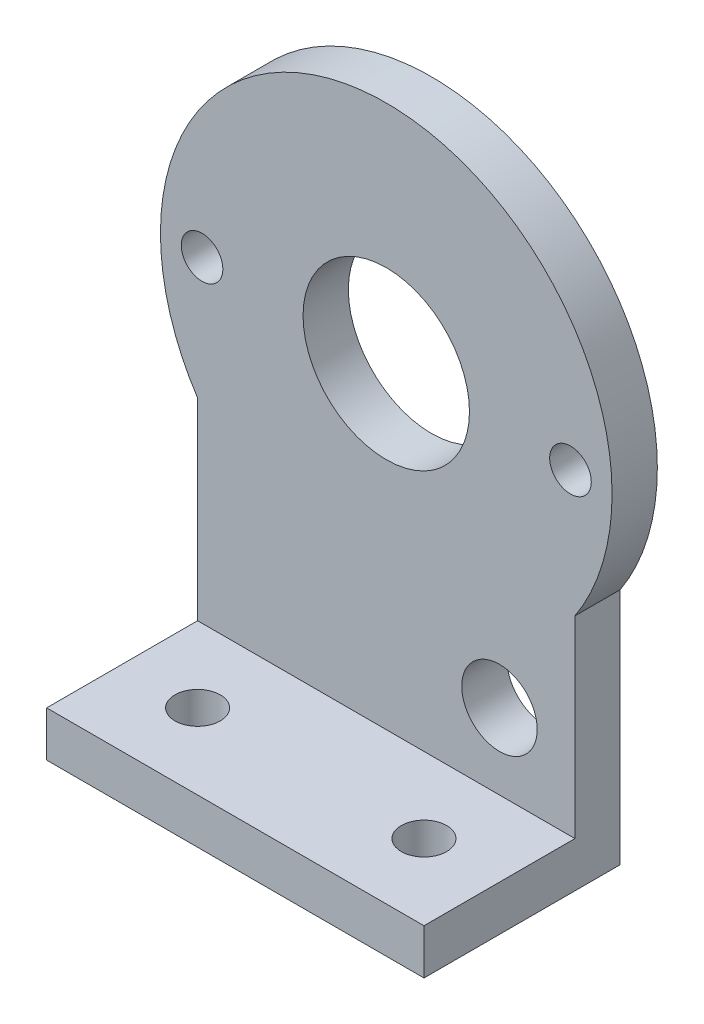
from build123d import *

# Parameters (mm, degrees)
SKETCH1_R           = 19
SKETCH1_W           = 31.75
SKETCH1_H           = 20.04044182
BOSS_EXTRUDE1_DEPTH = 3.81
SKETCH3_R           = 7
CUT_EXTRUDE1_DEPTH  = 37.118506337
SKETCH4_W           = 31.75
SKETCH4_H           = 3.81
BOSS_EXTRUDE2_DEPTH = 12.7
SKETCH5_R           = 1.905
CUT_EXTRUDE2_DEPTH  = 53.147185926
SKETCH6_R           = 1.75
CUT_EXTRUDE3_DEPTH  = 39.096199285
SKETCH7_R           = 3.175
CUT_EXTRUDE4_DEPTH  = 39.096199285


with BuildPart() as part:
    # Sketch1 → Boss-Extrude1 (new body)
    with BuildSketch(Plane.XY):
        Circle(SKETCH1_R)
        with Locations((0, -20.45977909)):
            Rectangle(SKETCH1_W, SKETCH1_H)
    extrude(amount=BOSS_EXTRUDE1_DEPTH)

    # Sketch3 → Cut-Extrude1 (cut, through all)
    with BuildSketch(Plane.XY.offset(3.81)):
        Circle(SKETCH3_R)
    extrude(amount=-CUT_EXTRUDE1_DEPTH, mode=Mode.SUBTRACT)

    # Sketch4 → Boss-Extrude2 (add)
    with BuildSketch(Plane.XY.offset(3.81)):
        with Locations((0, -28.575)):
            Rectangle(SKETCH4_W, SKETCH4_H)
    extrude(amount=BOSS_EXTRUDE2_DEPTH)

    # Sketch5 → Cut-Extrude2 (cut, through all)
    with BuildSketch(Plane(origin=(0, -26.67, 0), x_dir=(1, 0, 0), z_dir=(0, 1, 0))):
        with Locations((-9.525, -10.16)):
            Circle(SKETCH5_R)
        with Locations((9.525, -10.16)):
            Circle(SKETCH5_R)
    extrude(amount=-CUT_EXTRUDE2_DEPTH, mode=Mode.SUBTRACT)

    # Sketch6 → Cut-Extrude3 (cut, through all)
    with BuildSketch(Plane.XY.offset(3.81)):
        with Locations((15.5, 0)):
            Circle(SKETCH6_R)
        with Locations((-15.5, 0)):
            Circle(SKETCH6_R)
    extrude(amount=-CUT_EXTRUDE3_DEPTH, mode=Mode.SUBTRACT)

    # Sketch7 → Cut-Extrude4 (cut, through all)
    with BuildSketch(Plane.XY.offset(3.81)):
        with Locations((9.525, -20.32)):
            Circle(SKETCH7_R)
    extrude(amount=-CUT_EXTRUDE4_DEPTH, mode=Mode.SUBTRACT)


solid = part.part
